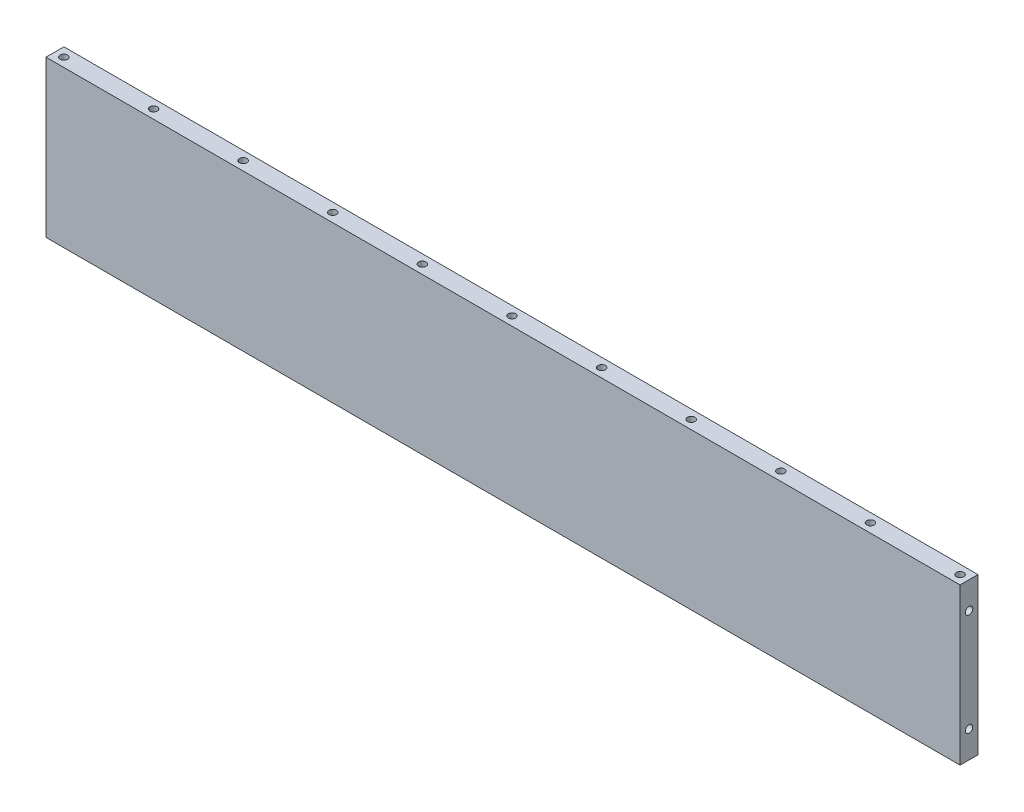
from build123d import *

# Parameters (mm, degrees)
SKETCH_2_W               = 306
SKETCH_2_H               = 52.262301256
EXTRUDE_1_DEPTH          = 3
M3X0_5_2_D               = 2.5
M3X0_5_2_DEPTH           = 8
M3X0_5_2_TIP             = 0.751075774
M3X0_5_2_ON_FACE_2_D     = 2.5
M3X0_5_2_ON_FACE_2_DEPTH = 8
M3X0_5_2_ON_FACE_2_TIP   = 0.751075774
PATTERN_LINEAR_1_COUNT   = 11
PATTERN_LINEAR_1_PITCH   = 30


# Read off the part's stored shape, not the designer's step: M3x0.5 ねじ穴用ねじ下穴ﾄﾞﾘﾙ1
with BuildPart() as part:
    # ｽｹｯﾁ2 → ﾎﾞｽ - 押し出し1 (new, symmetric)
    with BuildSketch(Plane.XY):
        Rectangle(SKETCH_2_W, SKETCH_2_H)
    extrude(amount=EXTRUDE_1_DEPTH, both=True)

    # M3x0.5 ねじ穴用ねじ下穴ﾄﾞﾘﾙ1 outline → M3x0.5 ねじ穴用ねじ下穴ﾄﾞﾘﾙ1 (revolve, cut)
    with BuildSketch(Plane(origin=(-150, 0, 0), x_dir=(1, 0, 0), z_dir=(0, 0, 1))):
        Polygon((1.25, -18.131150628), (0, -17.380074854), (0, -26.131150628), (1.25, -26.131150628), align=None)
        Polygon((0, 26.131150628), (0, 17.380074854), (1.25, 18.131150628), (1.25, 26.131150628), align=None)
    m3x0_5_1 = revolve(axis=Axis((-150, 0, 0), (0, 1, 0)), mode=Mode.SUBTRACT)

    # M3x0.5 ねじ穴用ねじ下穴ﾄﾞﾘﾙ2
    with Locations(Plane(origin=(-153, 17.131150628, 0), x_dir=(0, 0, -1), z_dir=(-1, 0, 0))):
        with Locations((0, 0), (0, 34.262301256)):
            Hole(M3X0_5_2_D / 2, depth=M3X0_5_2_DEPTH)
            with Locations((0, 0, -(M3X0_5_2_DEPTH + M3X0_5_2_TIP / 2))):  # 118° drill point
                Cone(0, M3X0_5_2_D / 2, M3X0_5_2_TIP, mode=Mode.SUBTRACT)

    # M3x0.5 ねじ穴用ねじ下穴ﾄﾞﾘﾙ2 on face 2
    with Locations(Plane(origin=(153, 17.131150628, 0), x_dir=(0, 0, 1), z_dir=(1, 0, 0))):
        with Locations((0, 0), (0, 34.262301256)):
            Hole(M3X0_5_2_ON_FACE_2_D / 2, depth=M3X0_5_2_ON_FACE_2_DEPTH)
            with Locations((0, 0, -(M3X0_5_2_ON_FACE_2_DEPTH + M3X0_5_2_ON_FACE_2_TIP / 2))):  # 118° drill point
                Cone(0, M3X0_5_2_ON_FACE_2_D / 2, M3X0_5_2_ON_FACE_2_TIP, mode=Mode.SUBTRACT)

    # 直線ﾊﾟﾀｰﾝ1: M3x0.5 ねじ穴用ねじ下穴ﾄﾞﾘﾙ1 ×11
    with Locations(*[(i * PATTERN_LINEAR_1_PITCH, 0, 0) for i in range(1, PATTERN_LINEAR_1_COUNT)]):
        add(m3x0_5_1, mode=Mode.SUBTRACT)


solid = part.part
